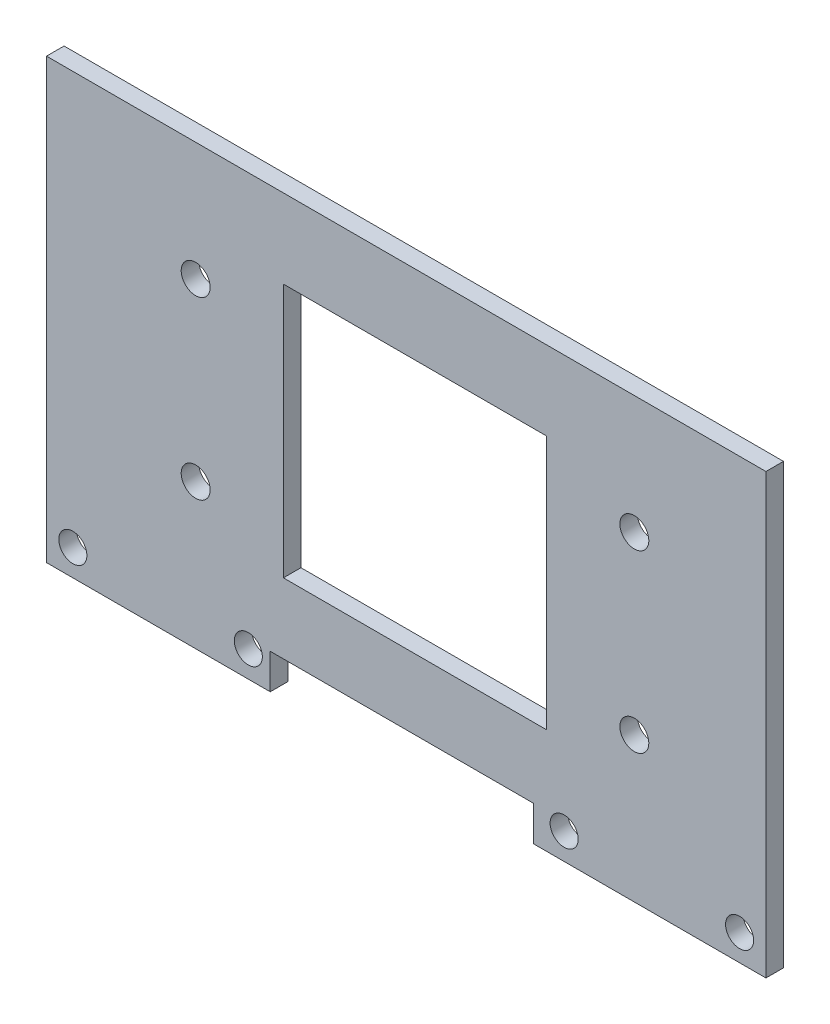
from build123d import *

# Parameters (mm, degrees)
SKETCH_1_W          = 80
SKETCH_1_H          = 50
SKETCH_1_W_2        = 30
SKETCH_1_H_2        = 29
EXTRUDE_1_DEPTH     = 2
SKETCH_5_W          = 2
SKETCH_5_H          = 50
EXTRUDE_2_DEPTH     = 2
SKETCH_2_W          = 30
SKETCH_2_H          = 4
CUT_EXTRUDE_1_DEPTH = 49.918299235
SKETCH_3_R          = 1.6
CUT_EXTRUDE_2_DEPTH = 49.918299235
SKETCH_6_W          = 1.5
SKETCH_6_H          = 4
CUT_EXTRUDE_4_DEPTH = 49.918299235
SKETCH_7_W          = 1.5
SKETCH_7_H          = 4
EXTRUDE_3_DEPTH     = 2
SKETCH_8_R          = 1.65
CUT_EXTRUDE_5_DEPTH = 49.918299235


with BuildPart() as part:
    # 草图1 → 凸台-拉伸1 (new body)
    with BuildSketch(Plane.XY):
        Rectangle(SKETCH_1_W, SKETCH_1_H)
        with Locations((0, 1.5)):
            Rectangle(SKETCH_1_W_2, SKETCH_1_H_2, mode=Mode.SUBTRACT)
    extrude(amount=EXTRUDE_1_DEPTH)

    # 草图5 → 凸台-拉伸2 (add)
    with BuildSketch(Plane.XY.offset(2)):
        with Locations((-41, 0)):
            Rectangle(SKETCH_5_W, SKETCH_5_H)
    extrude(amount=-EXTRUDE_2_DEPTH)

    # 草图2 → 切除-拉伸1 (cut, through all)
    with BuildSketch(Plane.XY.offset(2)):
        with Locations((0, -23)):
            Rectangle(SKETCH_2_W, SKETCH_2_H)
    extrude(amount=-CUT_EXTRUDE_1_DEPTH, mode=Mode.SUBTRACT)

    # 草图3 → 切除-拉伸2 (cut, through all)
    with BuildSketch(Plane.XY.offset(2)):
        with Locations((-39, -22)):
            Circle(SKETCH_3_R)
        with Locations((-19, -22)):
            Circle(SKETCH_3_R)
        with Locations((17, -22)):
            Circle(SKETCH_3_R)
        with Locations((37, -22)):
            Circle(SKETCH_3_R)
    extrude(amount=-CUT_EXTRUDE_2_DEPTH, mode=Mode.SUBTRACT)

    # 草图6 → 切除-拉伸4 (cut, through all)
    with BuildSketch(Plane.XY.offset(2)):
        with Locations((-15.75, -23)):
            Rectangle(SKETCH_6_W, SKETCH_6_H)
    extrude(amount=-CUT_EXTRUDE_4_DEPTH, mode=Mode.SUBTRACT)

    # 草图7 → 凸台-拉伸3 (add)
    with BuildSketch(Plane.XY.offset(2)):
        with Locations((14.25, -23)):
            Rectangle(SKETCH_7_W, SKETCH_7_H)
    extrude(amount=-EXTRUDE_3_DEPTH)

    # 草图8 → 切除-拉伸5 (cut, through all)
    with BuildSketch(Plane.XY.offset(2)):
        with Locations((-25, 11.5)):
            Circle(SKETCH_8_R)
        with Locations((25, 11.5)):
            Circle(SKETCH_8_R)
        with Locations((-25, -8.5)):
            Circle(SKETCH_8_R)
        with Locations((25, -8.5)):
            Circle(SKETCH_8_R)
    extrude(amount=-CUT_EXTRUDE_5_DEPTH, mode=Mode.SUBTRACT)


solid = part.part
